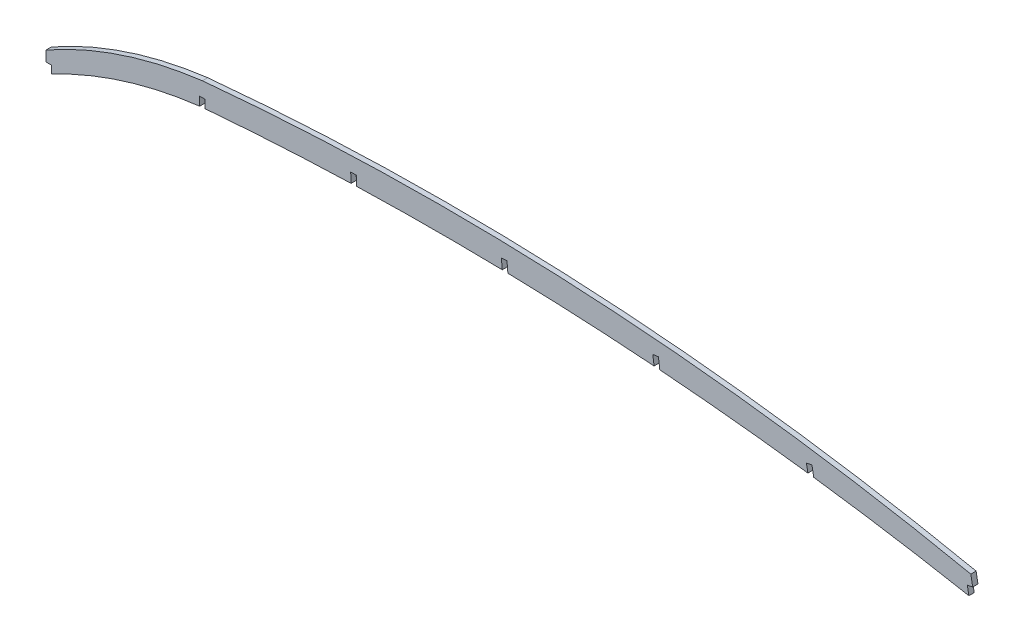
from build123d import *

# Parameters (mm, degrees)
BOSS_EXTRUDE1_DEPTH = 3.175
SKETCH2_W           = 3.3528
SKETCH2_H           = 6.477
SKETCH2_W_2         = 3.3782
SKETCH2_H_2         = 12.7
CUT_EXTRUDE1_DEPTH  = 577.346072705


with BuildPart() as part:
    # Sketch1 → Boss-Extrude1 (new body)
    with BuildSketch(Plane.XY):
        with BuildLine():
            Line((557.916984218, 99.326538403), (555.638244479, 111.822940833))
            ThreePointArc((555.638244479, 111.822940833), (325.782502236, 142.132503557), (93.98, 137.668))
            ThreePointArc((93.98, 137.668), (45.466310815, 126.795024577), (0, 106.68))
            Line((0, 106.68), (0, 93.98))
            ThreePointArc((0, 93.98), (45.52945751, 113.491169294), (93.98, 123.794671649))
            ThreePointArc((93.98, 123.794671649), (326.784483289, 127.411721364), (557.916984218, 99.326538403))
        make_face()
    extrude(amount=BOSS_EXTRUDE1_DEPTH)

    # Sketch2 → Cut-Extrude1 (cut, through all)
    with BuildSketch(Plane.XY.offset(3.175)):
        with Locations((1.6764, 97.2185)):
            Rectangle(SKETCH2_W, SKETCH2_H)
        with Locations((93.98, 122.498746884)):
            Rectangle(SKETCH2_W_2, SKETCH2_H_2)
        Polygon((183.054551015, 134.687145422), (186.429805755, 134.828179757), (186.960010022, 122.139252165), (183.584755283, 121.99821783), align=None)
        Polygon((364.577933431, 130.603714492), (367.926681813, 131.048820676), (369.239873525, 121.16904642), (365.891125143, 120.723940236), align=None)
        Polygon((298.533171127, -116.284523632), (299.081273341, -122.651898671), (295.917971315, -122.924194999), (295.369869101, -116.55681996), align=None)
        Polygon((273.590830142, 135.268456112), (276.956583497, 135.558179406), (278.045768811, 122.904971301), (274.680015455, 122.615248007), align=None)
        Polygon((456.854976279, 120.249363717), (460.178373044, 120.855391093), (461.793693389, 111.99712722), (458.470296624, 111.391099845), align=None)
        Polygon((553.540722528, 105.060688054), (556.864119293, 105.666715431), (558.657365749, 95.832721624), (555.333968984, 95.226694247), align=None)
    extrude(amount=-CUT_EXTRUDE1_DEPTH, mode=Mode.SUBTRACT)


solid = part.part
